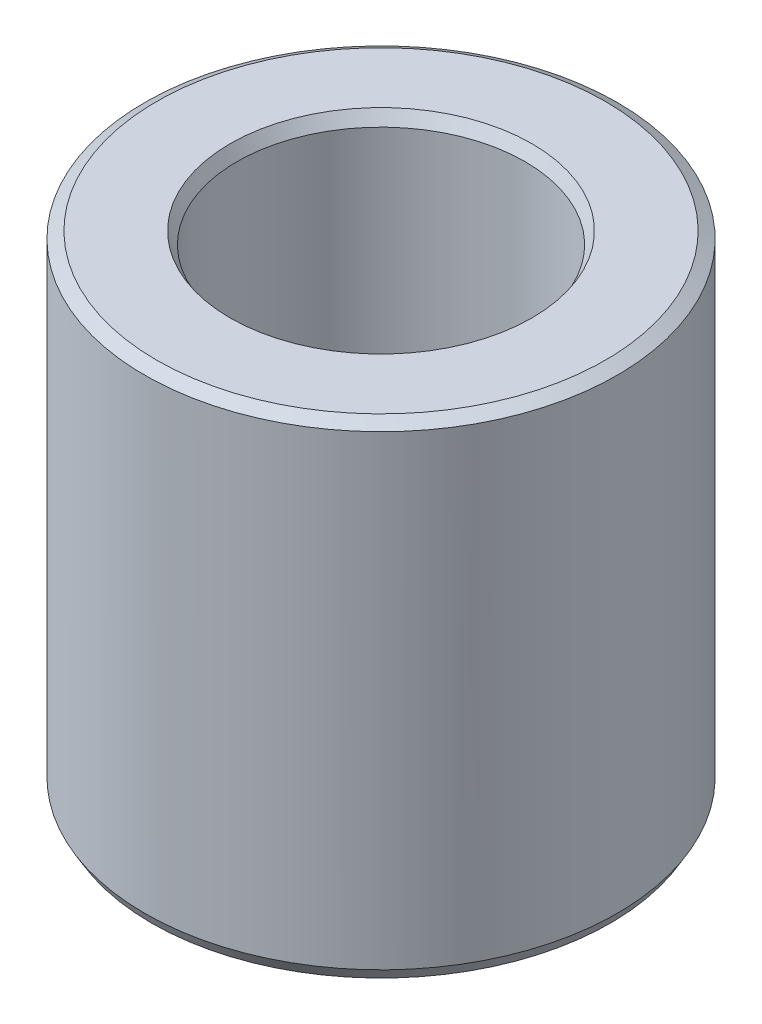
from build123d import *
from OCP.BRepFilletAPI import BRepFilletAPI_MakeChamfer

# Parameters (mm, degrees)
SKETCH1_R           = 10
BOSS_EXTRUDE1_DEPTH = 20.528602243
SKETCH2_R           = 6.094749053
CUT_EXTRUDE1_DEPTH  = 25.928367577
CHAMFER1_SIZE       = 0.293696241
CHAMFER1_SIZE2      = 0.508696812


with BuildPart() as part:
    # Sketch1 → Boss-Extrude1 (new body)
    with BuildSketch(Plane(origin=(0, 0, 0), x_dir=(1, 0, 0), z_dir=(0, 1, 0))):
        Circle(SKETCH1_R)
    extrude(amount=BOSS_EXTRUDE1_DEPTH)

    # Sketch2 → Cut-Extrude1 (cut, through all)
    with BuildSketch(Plane(origin=(0, 0, 0), x_dir=(1, 0, 0), z_dir=(0, 1, 0))):
        Circle(SKETCH2_R)
    extrude(amount=CUT_EXTRUDE1_DEPTH, mode=Mode.SUBTRACT)

    # Chamfer1: one chamfer whose edges measure the first distance from different faces: ONE call of the kernel's chamfer builder (chamfer() names one face for all edges)
    chamfer1_edges_1 = [part.edges().sort_by_distance(p)[0] for p in [
        (-6.094749053, 20.528602243, 0),
    ]]
    chamfer1_side_1 = [part.faces().sort_by_distance(p)[0] for p in [
        (-9.717157288, 20.528602243, 0),
    ]]
    chamfer1_edges_2 = [part.edges().sort_by_distance(p)[0] for p in [
        (-6.094749053, 0, 0),
    ]]
    chamfer1_side_2 = [part.faces().sort_by_distance(p)[0] for p in [
        (-6.094749053, 10.264301121, 0),
    ]]
    chamfer1_edges_3 = [part.edges().sort_by_distance(p)[0] for p in [
        (-10, 0, 0),
    ]]
    chamfer1_side_3 = [part.faces().sort_by_distance(p)[0] for p in [
        (-9.717157288, 0, 0),
    ]]
    chamfer1_edges_4 = [part.edges().sort_by_distance(p)[0] for p in [
        (-10, 20.528602243, 0),
    ]]
    chamfer1_side_4 = [part.faces().sort_by_distance(p)[0] for p in [
        (-10, 10.264301121, 0),
    ]]
    chamfer1 = BRepFilletAPI_MakeChamfer(part.part.solid().wrapped)
    for e in chamfer1_edges_1:
        chamfer1.Add(CHAMFER1_SIZE, CHAMFER1_SIZE2, e.wrapped, chamfer1_side_1[0].wrapped)  # the first distance lies on this face
    for e in chamfer1_edges_2:
        chamfer1.Add(CHAMFER1_SIZE, CHAMFER1_SIZE2, e.wrapped, chamfer1_side_2[0].wrapped)  # the first distance lies on this face
    for e in chamfer1_edges_3:
        chamfer1.Add(CHAMFER1_SIZE, CHAMFER1_SIZE2, e.wrapped, chamfer1_side_3[0].wrapped)  # the first distance lies on this face
    for e in chamfer1_edges_4:
        chamfer1.Add(CHAMFER1_SIZE, CHAMFER1_SIZE2, e.wrapped, chamfer1_side_4[0].wrapped)  # the first distance lies on this face
    add(Compound.cast(chamfer1.Shape()), mode=Mode.REPLACE)


solid = part.part
